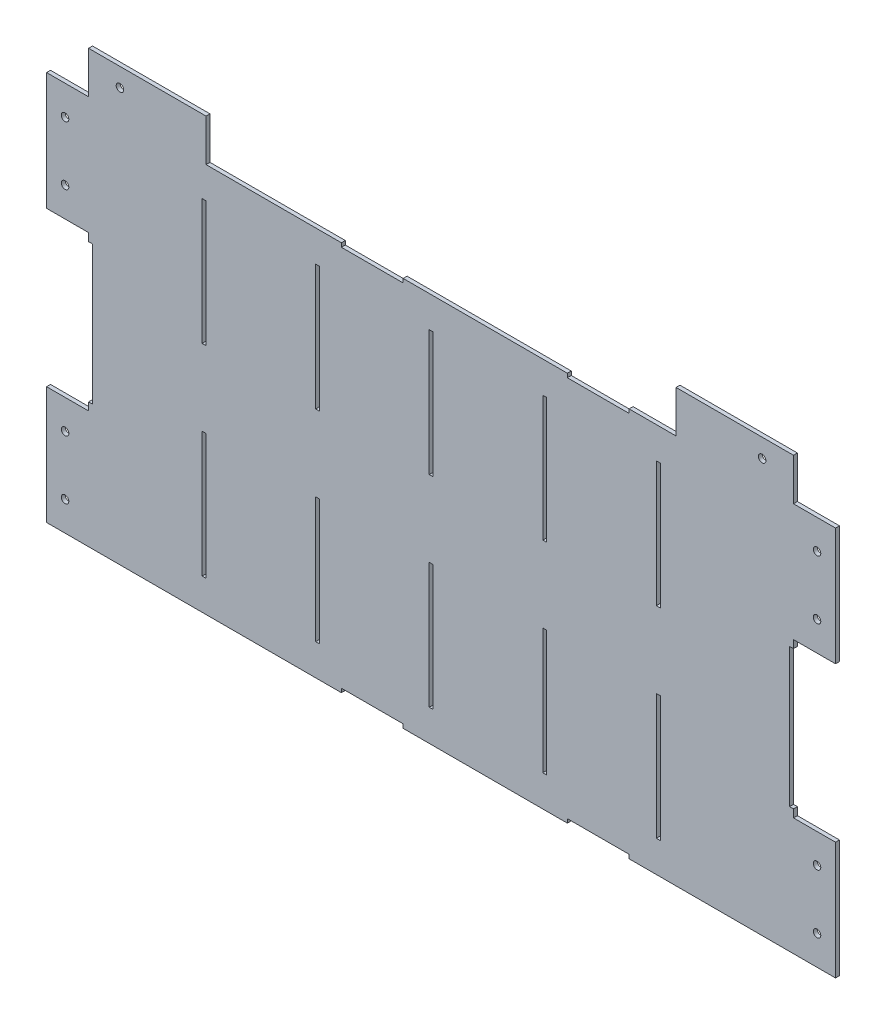
from build123d import *

# Parameters (mm, degrees)
SKETCH1_W                 = 570.860988324
SKETCH1_H                 = 315.575
BOSS_EXTRUDE1_DEPTH       = 3.175
SKETCH2_W                 = 3.175
SKETCH2_H                 = 101.6
CUT_EXTRUDE1_DEPTH        = 3.175
SKETCH7_W                 = 50
SKETCH7_H                 = 3.175
CUT_EXTRUDE5_DEPTH        = 3.175
LPATTERN2_COPY_1_SKETCH_W = 3.175
LPATTERN2_COPY_1_SKETCH_H = 101.6
LPATTERN2_COPY_1_DEPTH    = 3.175
LPATTERN2_COPY_2_SKETCH_W = 3.175
LPATTERN2_COPY_2_SKETCH_H = 101.6
LPATTERN2_COPY_2_DEPTH    = 3.175
LPATTERN2_COPY_3_SKETCH_W = 3.175
LPATTERN2_COPY_3_SKETCH_H = 101.6
LPATTERN2_COPY_3_DEPTH    = 3.175
LPATTERN2_COPY_4_SKETCH_W = 3.175
LPATTERN2_COPY_4_SKETCH_H = 101.6
LPATTERN2_COPY_4_DEPTH    = 3.175
LPATTERN2_COPY_5_SKETCH_W = 3.175
LPATTERN2_COPY_5_SKETCH_H = 101.6
LPATTERN2_COPY_5_DEPTH    = 3.175
LPATTERN2_COPY_6_SKETCH_W = 3.175
LPATTERN2_COPY_6_SKETCH_H = 101.6
LPATTERN2_COPY_6_DEPTH    = 3.175
LPATTERN2_COPY_7_SKETCH_W = 3.175
LPATTERN2_COPY_7_SKETCH_H = 101.6
LPATTERN2_COPY_7_DEPTH    = 3.175
LPATTERN2_COPY_8_SKETCH_W = 3.175
LPATTERN2_COPY_8_SKETCH_H = 101.6
LPATTERN2_COPY_8_DEPTH    = 3.175
SKETCH9_W                 = 95.12808
SKETCH9_H                 = 34.036
SKETCH9_R                 = 3.048
SKETCH9_W_2               = 34.036
SKETCH9_H_2               = 95.25
BOSS_EXTRUDE3_DEPTH       = 3.175
SKETCH10_W                = 3.175
SKETCH10_H                = 112.375
CUT_EXTRUDE6_DEPTH        = 373.646181611


with BuildPart() as part:
    # Sketch1 → Boss-Extrude1 (new body)
    with BuildSketch(Plane.XY):
        Rectangle(SKETCH1_W, SKETCH1_H)
    extrude(amount=BOSS_EXTRUDE1_DEPTH)

    # Sketch2 → Cut-Extrude1 (cut)
    with BuildSketch(Plane.XY.offset(3.175)):
        with Locations((-191.887994162, -81.5875)):
            Rectangle(SKETCH2_W, SKETCH2_H)
    cut_extrude1 = extrude(amount=-CUT_EXTRUDE1_DEPTH, mode=Mode.SUBTRACT)

    # Sketch7 → Cut-Extrude5 (cut)
    with BuildSketch(Plane.XY.offset(3.175)):
        with Locations((127.304934912, -156.2)):
            Rectangle(SKETCH7_W, SKETCH7_H)
        with Locations((-55.695065088, -156.2)):
            Rectangle(SKETCH7_W, SKETCH7_H)
    cut_extrude5 = extrude(amount=-CUT_EXTRUDE5_DEPTH, mode=Mode.SUBTRACT)

    # Mirror3: Cut-Extrude1 across plane
    add(cut_extrude1.mirror(Plane.ZX), mode=Mode.SUBTRACT)

    # LPattern2 copy 1 sketch → LPattern2 copy 1 (cut)
    with BuildSketch(Plane(origin=(91.96, 0, 3.175), x_dir=(1, 0, 0), z_dir=(0, 0, 1))):
        with Locations((-191.887994162, 81.5875)):
            Rectangle(LPATTERN2_COPY_1_SKETCH_W, LPATTERN2_COPY_1_SKETCH_H)
    extrude(amount=-LPATTERN2_COPY_1_DEPTH, mode=Mode.SUBTRACT)

    # LPattern2 copy 2 sketch → LPattern2 copy 2 (cut)
    with BuildSketch(Plane(origin=(183.92, 0, 3.175), x_dir=(1, 0, 0), z_dir=(0, 0, 1))):
        with Locations((-191.887994162, 81.5875)):
            Rectangle(LPATTERN2_COPY_2_SKETCH_W, LPATTERN2_COPY_2_SKETCH_H)
    extrude(amount=-LPATTERN2_COPY_2_DEPTH, mode=Mode.SUBTRACT)

    # LPattern2 copy 3 sketch → LPattern2 copy 3 (cut)
    with BuildSketch(Plane(origin=(275.88, 0, 3.175), x_dir=(1, 0, 0), z_dir=(0, 0, 1))):
        with Locations((-191.887994162, 81.5875)):
            Rectangle(LPATTERN2_COPY_3_SKETCH_W, LPATTERN2_COPY_3_SKETCH_H)
    extrude(amount=-LPATTERN2_COPY_3_DEPTH, mode=Mode.SUBTRACT)

    # LPattern2 copy 4 sketch → LPattern2 copy 4 (cut)
    with BuildSketch(Plane(origin=(367.84, 0, 3.175), x_dir=(1, 0, 0), z_dir=(0, 0, 1))):
        with Locations((-191.887994162, 81.5875)):
            Rectangle(LPATTERN2_COPY_4_SKETCH_W, LPATTERN2_COPY_4_SKETCH_H)
    extrude(amount=-LPATTERN2_COPY_4_DEPTH, mode=Mode.SUBTRACT)

    # LPattern2 copy 5 sketch → LPattern2 copy 5 (cut)
    with BuildSketch(Plane(origin=(91.96, 0, 3.175), x_dir=(1, 0, 0), z_dir=(0, 0, 1))):
        with Locations((-191.887994162, -81.5875)):
            Rectangle(LPATTERN2_COPY_5_SKETCH_W, LPATTERN2_COPY_5_SKETCH_H)
    extrude(amount=-LPATTERN2_COPY_5_DEPTH, mode=Mode.SUBTRACT)

    # LPattern2 copy 6 sketch → LPattern2 copy 6 (cut)
    with BuildSketch(Plane(origin=(183.92, 0, 3.175), x_dir=(1, 0, 0), z_dir=(0, 0, 1))):
        with Locations((-191.887994162, -81.5875)):
            Rectangle(LPATTERN2_COPY_6_SKETCH_W, LPATTERN2_COPY_6_SKETCH_H)
    extrude(amount=-LPATTERN2_COPY_6_DEPTH, mode=Mode.SUBTRACT)

    # LPattern2 copy 7 sketch → LPattern2 copy 7 (cut)
    with BuildSketch(Plane(origin=(275.88, 0, 3.175), x_dir=(1, 0, 0), z_dir=(0, 0, 1))):
        with Locations((-191.887994162, -81.5875)):
            Rectangle(LPATTERN2_COPY_7_SKETCH_W, LPATTERN2_COPY_7_SKETCH_H)
    extrude(amount=-LPATTERN2_COPY_7_DEPTH, mode=Mode.SUBTRACT)

    # LPattern2 copy 8 sketch → LPattern2 copy 8 (cut)
    with BuildSketch(Plane(origin=(367.84, 0, 3.175), x_dir=(1, 0, 0), z_dir=(0, 0, 1))):
        with Locations((-191.887994162, -81.5875)):
            Rectangle(LPATTERN2_COPY_8_SKETCH_W, LPATTERN2_COPY_8_SKETCH_H)
    extrude(amount=-LPATTERN2_COPY_8_DEPTH, mode=Mode.SUBTRACT)

    # Sketch9 → Boss-Extrude3 (add)
    # profile 1 of 3: a face of its own
    with BuildSketch(Plane(origin=(0, 0, 0), x_dir=(-1, 0, 0), z_dir=(0, 0, -1))):
        with Locations((-237.866454162, 174.8055)):
            Rectangle(SKETCH9_W, SKETCH9_H)
        with Locations((-260.030494162, 176.8375)):
            Circle(SKETCH9_R, mode=Mode.SUBTRACT)
    # profile 2 of 3: a face of its own
    with BuildSketch(Plane(origin=(0, 0, 0), x_dir=(-1, 0, 0), z_dir=(0, 0, -1))):
        with Locations((-302.448494162, 110.1625)):
            Rectangle(SKETCH9_W_2, SKETCH9_H_2)
        with Locations((-304.480494162, 86.35)):
            Circle(SKETCH9_R, mode=Mode.SUBTRACT)
        with Locations((-304.480494162, 133.975)):
            Circle(SKETCH9_R, mode=Mode.SUBTRACT)
    # profile 3 of 3: a face of its own
    with BuildSketch(Plane(origin=(0, 0, 0), x_dir=(-1, 0, 0), z_dir=(0, 0, -1))):
        with Locations((-302.448494162, -110.1625)):
            Rectangle(SKETCH9_W_2, SKETCH9_H_2)
        with Locations((-304.480494162, -133.975)):
            Circle(SKETCH9_R, mode=Mode.SUBTRACT)
        with Locations((-304.480494162, -86.35)):
            Circle(SKETCH9_R, mode=Mode.SUBTRACT)
    boss_extrude3 = extrude(amount=-BOSS_EXTRUDE3_DEPTH)

    # Mirror4: Boss-Extrude3 across plane
    add(boss_extrude3.mirror(Plane(origin=(0, 0, 0), x_dir=(0, 0, 1), z_dir=(1, 0, 0))))

    # Mirror5: Cut-Extrude5 across plane
    add(cut_extrude5.mirror(Plane.ZX), mode=Mode.SUBTRACT)

    # Sketch10 → Cut-Extrude6 (cut, through all)
    with BuildSketch(Plane(origin=(0, 0, 0), x_dir=(-1, 0, 0), z_dir=(0, 0, -1))):
        with Locations((-283.842994162, 0)):
            Rectangle(SKETCH10_W, SKETCH10_H)
    cut_extrude6 = extrude(amount=-CUT_EXTRUDE6_DEPTH, mode=Mode.SUBTRACT)

    # Mirror6: Cut-Extrude6 across plane
    add(cut_extrude6.mirror(Plane(origin=(0, 0, 0), x_dir=(0, 0, 1), z_dir=(1, 0, 0))), mode=Mode.SUBTRACT)


solid = part.part
